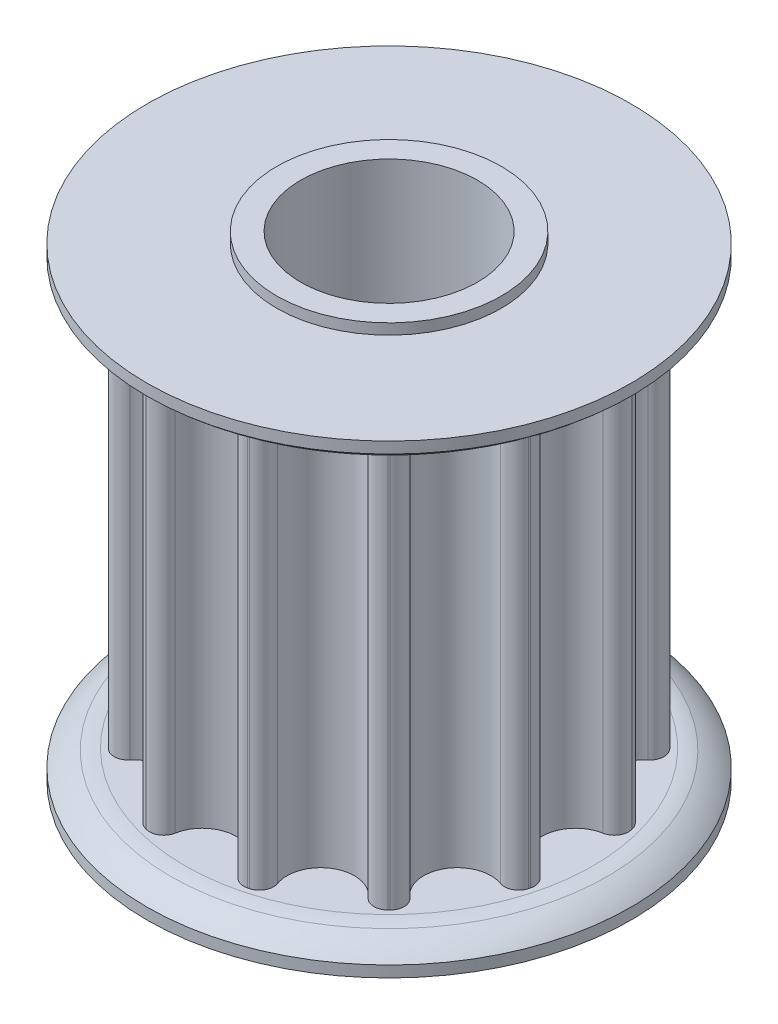
from build123d import *

# Parameters (mm, degrees)
SKETCH1_R          = 8.977796406
TOOTHOD_DEPTH      = 9.2456
TOOTHPROFILE_DEPTH = 23.430473336
TOOTHPATTERN_COUNT = 12
SKETCH6_W          = 5.08
SKETCH6_H          = 0.4826
BORE_DEPTH         = 19.989555373
BORE_DEPTH_BACK    = 19.989555373
SKETCH7_R          = 4


with BuildPart() as part:
    # Sketch1 → ToothOD (new, symmetric)
    with BuildSketch(Plane(origin=(0, 0, 0), x_dir=(1, 0, 0), z_dir=(0, 1, 0))):
        Circle(SKETCH1_R)
    extrude(amount=TOOTHOD_DEPTH, both=True)

    # Sketch2 → ToothProfile (cut, through all)
    with BuildSketch(Plane(origin=(0, 9.2456, 0), x_dir=(1, 0, 0), z_dir=(0, 1, 0))):
        with BuildLine():
            ThreePointArc((-1.501752794, 8.177535128), (0, 6.917796406), (1.501752794, 8.177535128))
            ThreePointArc((1.501752794, 8.177535128), (1.784898523, 8.602004268), (2.28897191, 8.681096469))
            ThreePointArc((2.28897191, 8.681096469), (0, 8.977796406), (-2.28897191, 8.681096469))
            ThreePointArc((-2.28897191, 8.681096469), (-1.784898523, 8.602004268), (-1.501752794, 8.177535128))
        make_face()
    toothprofile = extrude(amount=-TOOTHPROFILE_DEPTH, mode=Mode.SUBTRACT)

    # ToothPattern: ToothProfile ×12 about axis
    toothpattern_axis = Axis((0, 9.2456, 0), (0, -1, 0))
    for i in range(1, TOOTHPATTERN_COUNT):
        add(toothprofile.rotate(toothpattern_axis, i * 360 / TOOTHPATTERN_COUNT), mode=Mode.SUBTRACT)

    # Sketch4 → Flange (revolve)
    with BuildSketch(Plane.XY):
        with BuildLine():
            Line((0, -9.2456), (9.231796406, -9.2456))
            ThreePointArc((9.231796406, -9.2456), (9.557552396, -9.271222571), (9.877368734, -9.338237424))
            ThreePointArc((9.877368734, -9.338237424), (10.445097311, -9.619797125), (10.946296406, -10.0076))
            Line((10.946296406, -10.0076), (10.946296406, -10.5156))
            Line((10.946296406, -10.5156), (0, -10.5156))
            Line((0, -10.5156), (0, -9.2456))
        make_face()
        with BuildLine():
            Line((10.946296406, 10.5156), (10.946296406, 10.0076))
            ThreePointArc((10.946296406, 10.0076), (10.445097311, 9.619797125), (9.877368734, 9.338237424))
            ThreePointArc((9.877368734, 9.338237424), (9.557552396, 9.271222571), (9.231796406, 9.2456))
            Line((9.231796406, 9.2456), (0, 9.2456))
            Line((0, 9.2456), (0, 10.5156))
            Line((0, 10.5156), (10.946296406, 10.5156))
        make_face()
    revolve(axis=Axis((0, 12.09802, 0), (0, -1, 0)))

    # Sketch6 → TopBearingBoss (revolve)
    with BuildSketch(Plane.XY):
        with Locations((2.54, 10.7569)):
            Rectangle(SKETCH6_W, SKETCH6_H)
    topbearingboss = revolve(axis=Axis((0, 12.09802, 0), (0, -1, 0)))

    # BottomBearingBoss: TopBearingBoss across plane
    add(topbearingboss.mirror(Plane.ZX))

    # Sketch7 → Bore (cut, two sides: drawn at the far end of the back side and taken through both)
    with BuildSketch(Plane.XZ.offset(-BORE_DEPTH_BACK)):
        Circle(SKETCH7_R)
    extrude(amount=BORE_DEPTH + BORE_DEPTH_BACK, mode=Mode.SUBTRACT)


solid = part.part
